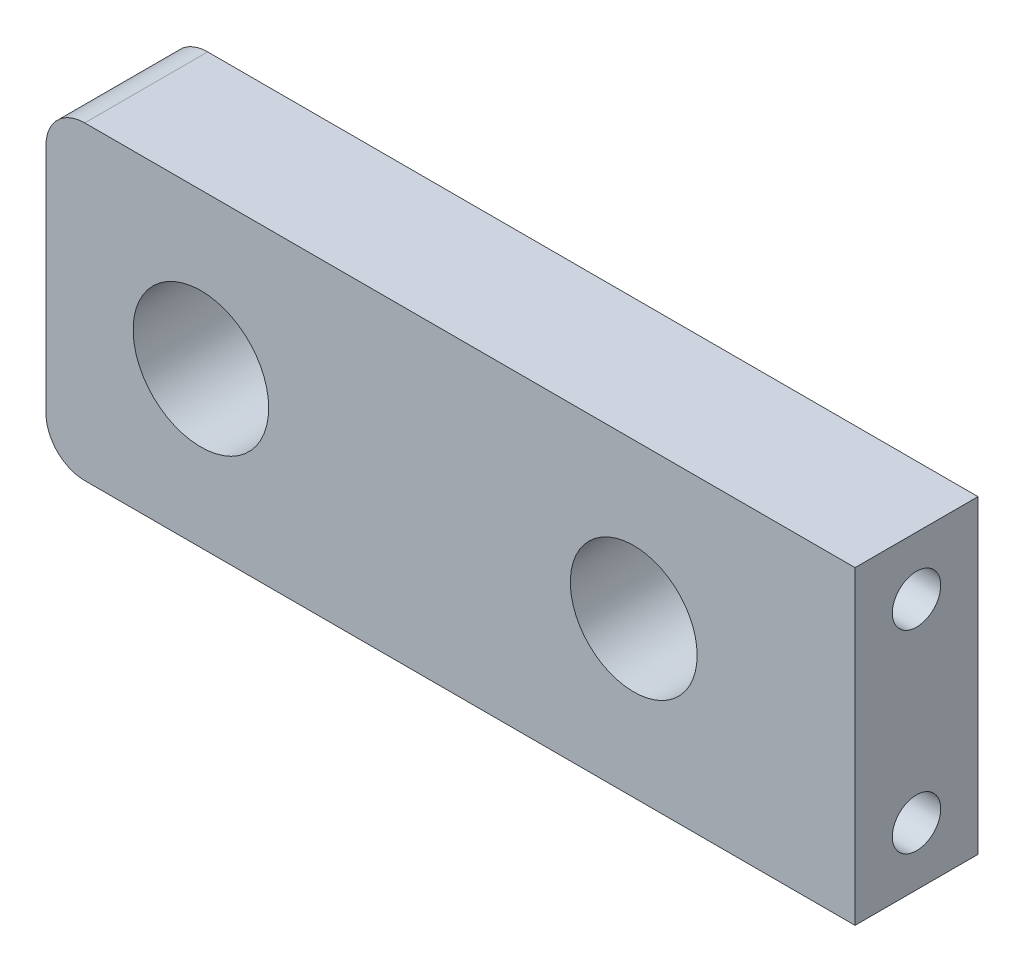
from build123d import *

# Parameters (mm, degrees)
SKETCH1_W           = 41.782
SKETCH1_H           = 16
BOSS_EXTRUDE1_DEPTH = 6.35
SKETCH1_6_R         = 3.275
SKETCH1_6_R_2       = 3.5
CUT_EXTRUDE1_DEPTH  = 6.35
FILLET1_R           = 2
SKETCH2_R           = 1.25
CUT_EXTRUDE2_DEPTH  = 4


with BuildPart() as part:
    # Sketch1 → Boss-Extrude1 (new body)
    with BuildSketch(Plane.XY):
        with Locations((20.891, 8)):
            Rectangle(SKETCH1_W, SKETCH1_H)
    extrude(amount=BOSS_EXTRUDE1_DEPTH)

    # Sketch1<6> → Cut-Extrude1 (cut)
    with BuildSketch(Plane.XY):
        with Locations((30.352, 8)):
            Circle(SKETCH1_6_R)
        with Locations((8, 8)):
            Circle(SKETCH1_6_R_2)
    extrude(amount=CUT_EXTRUDE1_DEPTH, mode=Mode.SUBTRACT)

    # Fillet1
    fillet1_edges = [part.edges().sort_by_distance(p)[0] for p in [
        (0, 16, 3.175),
        (0, 0, 3.175),
    ]]
    fillet(fillet1_edges, radius=FILLET1_R)

    # Sketch2 → Cut-Extrude2 (cut)
    with BuildSketch(Plane(origin=(41.782, 0, 0), x_dir=(0, 0, -1), z_dir=(1, 0, 0))):
        with Locations((-3.175, 13)):
            Circle(SKETCH2_R)
        with Locations((-3.175, 3)):
            Circle(SKETCH2_R)
    extrude(amount=-CUT_EXTRUDE2_DEPTH, mode=Mode.SUBTRACT)


solid = part.part
